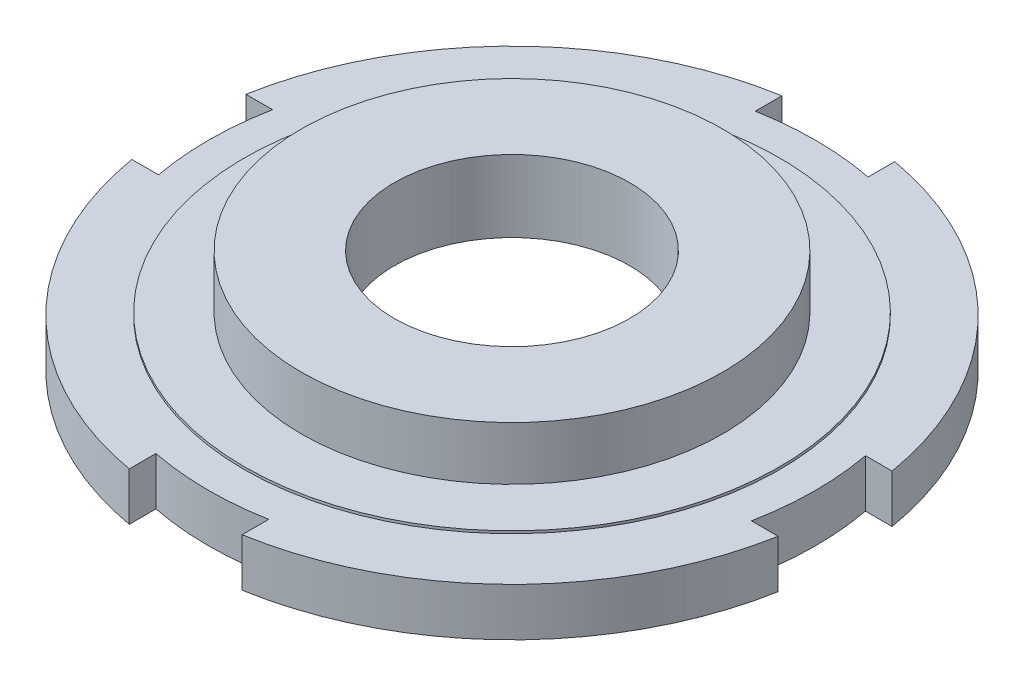
from build123d import *

# Parameters (mm, degrees)
SKETCH1_R           = 13.97
BOSS_EXTRUDE2_DEPTH = 6.0000007
CUT_EXTRUDE1_DEPTH  = 3.81
SKETCH3_R           = 31.75
CUT_EXTRUDE2_DEPTH  = 0.3
SKETCH5_R           = 25.001
SKETCH5_R_2         = 13.97
BOSS_EXTRUDE3_DEPTH = 6.35
CUT_EXTRUDE3_START  = -0.3
SKETCH6_R           = 50.8
SKETCH6_R_2         = 31.75
CUT_EXTRUDE3_DEPTH  = 0.3


with BuildPart() as part:
    # Sketch1 → Boss-Extrude2 (new body)
    with BuildSketch(Plane(origin=(0, 0, 0), x_dir=(1, 0, 0), z_dir=(0, 1, 0))):
        with BuildLine():
            Line((35.405449863, 6.5405), (38.565312338, 6.5405))
            ThreePointArc((38.565312338, 6.5405), (27.795594479, 27.522107178), (6.9215, 38.498757042))
            Line((6.9215, 38.498757042), (6.9215, 35.332942957))
            ThreePointArc((6.9215, 35.332942957), (0.19391896, 36.003977776), (-6.5405, 35.405449863))
            Line((-6.5405, 35.405449863), (-6.5405, 38.565312338))
            ThreePointArc((-6.5405, 38.565312338), (-27.522107178, 27.795594479), (-38.498757042, 6.9215))
            Line((-38.498757042, 6.9215), (-35.332942957, 6.9215))
            ThreePointArc((-35.332942957, 6.9215), (-36.003977776, 0.19391896), (-35.405449863, -6.5405))
            Line((-35.405449863, -6.5405), (-38.565312338, -6.5405))
            ThreePointArc((-38.565312338, -6.5405), (-27.795594479, -27.522107178), (-6.9215, -38.498757042))
            Line((-6.9215, -38.498757042), (-6.9215, -35.332942957))
            ThreePointArc((-6.9215, -35.332942957), (-0.19391896, -36.003977776), (6.5405, -35.405449863))
            Line((6.5405, -35.405449863), (6.5405, -38.565312338))
            ThreePointArc((6.5405, -38.565312338), (27.522107178, -27.795594479), (38.498757042, -6.9215))
            Line((38.498757042, -6.9215), (35.332942957, -6.9215))
            ThreePointArc((35.332942957, -6.9215), (36.003977776, -0.19391896), (35.405449863, 6.5405))
        make_face()
        Circle(SKETCH1_R, mode=Mode.SUBTRACT)
    extrude(amount=BOSS_EXTRUDE2_DEPTH)

    # Sketch2 → Cut-Extrude1 (cut)
    with BuildSketch(Plane.XZ):
        with BuildLine():
            Line((17.377665752, -10.033), (-0.286554615, -40.628327152))
            ThreePointArc((-0.286554615, -40.628327152), (-2.416432138, -40.557415308), (-4.539661745, -40.374924792))
            Line((-4.539661745, -40.374924792), (8.196212586, -18.315743371))
            ThreePointArc((8.196212586, -18.315743371), (-13.440862054, 14.899247741), (17.377665752, -10.033))
        make_face()
    extrude(amount=-CUT_EXTRUDE1_DEPTH, mode=Mode.SUBTRACT)

    # Sketch3 → Cut-Extrude2 (cut)
    with BuildSketch(Plane.XZ):
        Circle(SKETCH3_R)
    extrude(amount=-CUT_EXTRUDE2_DEPTH, mode=Mode.SUBTRACT)

    # Sketch5 → Boss-Extrude3 (add)
    with BuildSketch(Plane(origin=(0, 6.0000007, 0), x_dir=(1, 0, 0), z_dir=(0, 1, 0))):
        Circle(SKETCH5_R)
        Circle(SKETCH5_R_2, mode=Mode.SUBTRACT)
    extrude(amount=BOSS_EXTRUDE3_DEPTH)

    # Sketch6 → Cut-Extrude3 (cut)
    with BuildSketch(Plane(origin=(0, 6.0000007, 0), x_dir=(1, 0, 0), z_dir=(0, 1, 0)).offset(CUT_EXTRUDE3_START)):
        Circle(SKETCH6_R)
        Circle(SKETCH6_R_2, mode=Mode.SUBTRACT)
    extrude(amount=CUT_EXTRUDE3_DEPTH, mode=Mode.SUBTRACT)


solid = part.part
